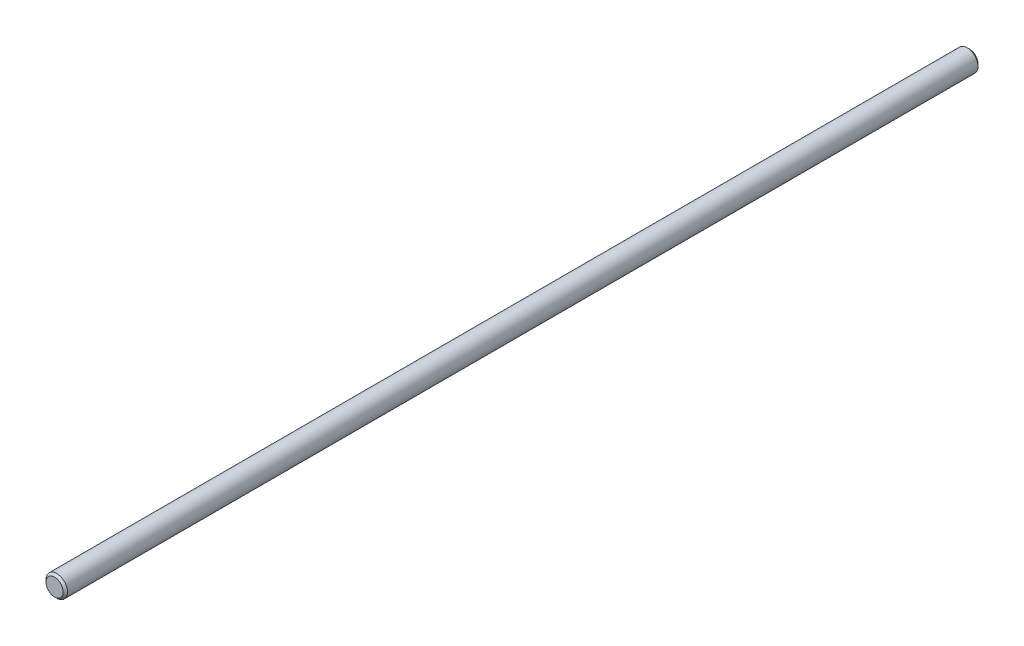
from build123d import *

# Parameters (mm, degrees)
SKETCH1_R      = 5
EXTRUDE1_DEPTH = 213.106
CHAMFER1_SIZE  = 1


with BuildPart() as part:
    # Sketch1 → Extrude1 (new, symmetric)
    with BuildSketch(Plane.XY):
        Circle(SKETCH1_R)
    extrude(amount=EXTRUDE1_DEPTH, both=True)

    # Chamfer1
    chamfer1_edges = [part.edges().sort_by_distance(p)[0] for p in [
        (-5, 0, -213.106),
        (-5, 0, 213.106),
    ]]
    chamfer(chamfer1_edges, length=CHAMFER1_SIZE)


solid = part.part
